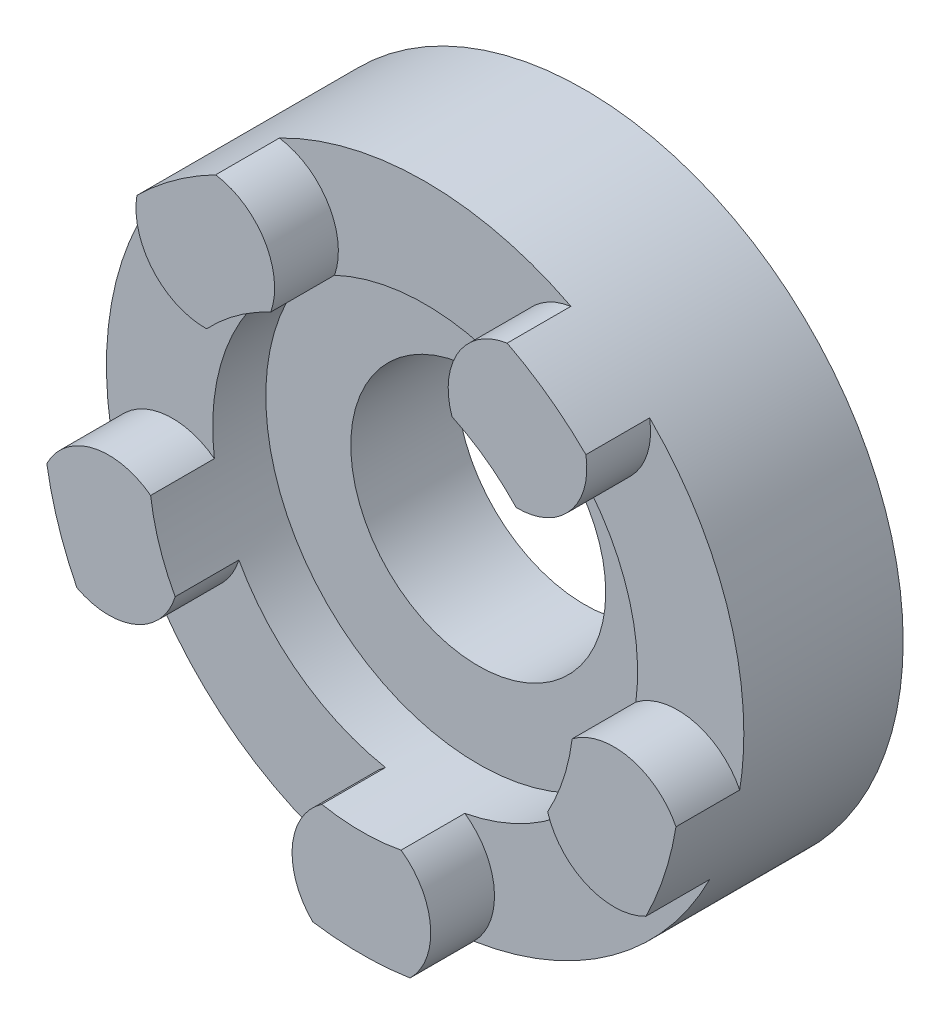
from build123d import *
from build123d.topology import SkipClean

# Parameters (mm, degrees)
SKETCH1_R           = 15
SKETCH1_R_2         = 6
BOSS_EXTRUDE1_DEPTH = 5
BOSS_EXTRUDE2_START = 2.5
SKETCH2_R           = 15
SKETCH2_R_2         = 10
BOSS_EXTRUDE2_DEPTH = 2.5
BOSS_EXTRUDE4_START = 3
BOSS_EXTRUDE4_DEPTH = 3


with BuildPart() as part:
    # Sketch1 → Boss-Extrude1 (new body)
    with BuildSketch(Plane.XY):
        Circle(SKETCH1_R)
        Circle(SKETCH1_R_2, mode=Mode.SUBTRACT)
    extrude(amount=-BOSS_EXTRUDE1_DEPTH)

    # Sketch2 → Boss-Extrude2 (add)
    with BuildSketch(Plane.XY.offset(BOSS_EXTRUDE2_START)):
        Circle(SKETCH2_R)
        Circle(SKETCH2_R_2, mode=Mode.SUBTRACT)
    extrude(amount=-BOSS_EXTRUDE2_DEPTH)

    # Sketch3 → Boss-Extrude4 (add)
    with SkipClean():  # the faces are left unmerged after this step: merging them gives an invalid solid
        with BuildSketch(Plane.XY.offset(2.5).offset(BOSS_EXTRUDE4_START)):
            with BuildLine():
                ThreePointArc((-2.290603582, -14.824072829), (0, -15), (2.290603582, -14.824072829))
                ThreePointArc((2.290603582, -14.824072829), (3.086155614, -13.560105094), (3.235238064, -12.074072829))
                ThreePointArc((3.235238064, -12.074072829), (2.788392741, -10.80499404), (1.867509855, -9.824072829))
                ThreePointArc((1.867509855, -9.824072829), (0, -10), (-1.867509855, -9.824072829))
                ThreePointArc((-1.867509855, -9.824072829), (-2.788392741, -10.80499404), (-3.235238064, -12.074072829))
                ThreePointArc((-3.235238064, -12.074072829), (-3.086155614, -13.560105094), (-2.290603582, -14.824072829))
            make_face()
            with BuildLine():
                ThreePointArc((-14.806366496, -2.402396967), (-14.265847744, -4.635254916), (-13.390695627, -6.759383893))
                ThreePointArc((-13.390695627, -6.759383893), (-11.942751779, -7.125411327), (-10.483382099, -6.807987938))
                ThreePointArc((-10.483382099, -6.807987938), (-9.414499246, -5.990845869), (-8.766156198, -4.811912875))
                ThreePointArc((-8.766156198, -4.811912875), (-9.510565163, -3.090169944), (-9.920340763, -1.259698041))
                ThreePointArc((-9.920340763, -1.259698041), (-11.137820734, -0.687007696), (-12.482869184, -0.654199453))
                ThreePointArc((-12.482869184, -0.654199453), (-13.850100843, -1.255194512), (-14.806366496, -2.402396967))
            make_face()
            with BuildLine():
                ThreePointArc((-6.860234162, 13.339309849), (-8.816778784, 12.135254916), (-10.566508613, 10.64654384))
                ThreePointArc((-10.566508613, 10.64654384), (-10.467182133, 9.15635871), (-9.714324518, 7.866504888))
                ThreePointArc((-9.714324518, 7.866504888), (-8.606873263, 7.102447672), (-7.285292336, 6.850147121))
                ThreePointArc((-7.285292336, 6.850147121), (-5.877852523, 8.090169944), (-4.263597916, 9.045536624))
                ThreePointArc((-4.263597916, 9.045536624), (-4.095159033, 10.380399934), (-4.479599369, 11.669755331))
                ThreePointArc((-4.479599369, 11.669755331), (-5.473677455, 12.784352223), (-6.860234162, 13.339309849))
            make_face()
            with BuildLine():
                ThreePointArc((10.566508613, 10.64654384), (8.816778784, 12.135254916), (6.860234162, 13.339309849))
                ThreePointArc((6.860234162, 13.339309849), (5.473677455, 12.784352223), (4.479599369, 11.669755331))
                ThreePointArc((4.479599369, 11.669755331), (4.095159033, 10.380399934), (4.263597916, 9.045536624))
                ThreePointArc((4.263597916, 9.045536624), (5.877852523, 8.090169944), (7.285292336, 6.850147121))
                ThreePointArc((7.285292336, 6.850147121), (8.606873263, 7.102447672), (9.714324518, 7.866504888))
                ThreePointArc((9.714324518, 7.866504888), (10.467182133, 9.15635871), (10.566508613, 10.64654384))
            make_face()
            with BuildLine():
                ThreePointArc((13.390695627, -6.759383893), (14.265847744, -4.635254916), (14.806366496, -2.402396967))
                ThreePointArc((14.806366496, -2.402396967), (13.850100843, -1.255194512), (12.482869184, -0.654199453))
                ThreePointArc((12.482869184, -0.654199453), (11.137820734, -0.687007696), (9.920340763, -1.259698041))
                ThreePointArc((9.920340763, -1.259698041), (9.510565163, -3.090169944), (8.766156198, -4.811912875))
                ThreePointArc((8.766156198, -4.811912875), (9.414499246, -5.990845869), (10.483382099, -6.807987938))
                ThreePointArc((10.483382099, -6.807987938), (11.942751779, -7.125411327), (13.390695627, -6.759383893))
            make_face()
        extrude(amount=-BOSS_EXTRUDE4_DEPTH)


solid = part.part
